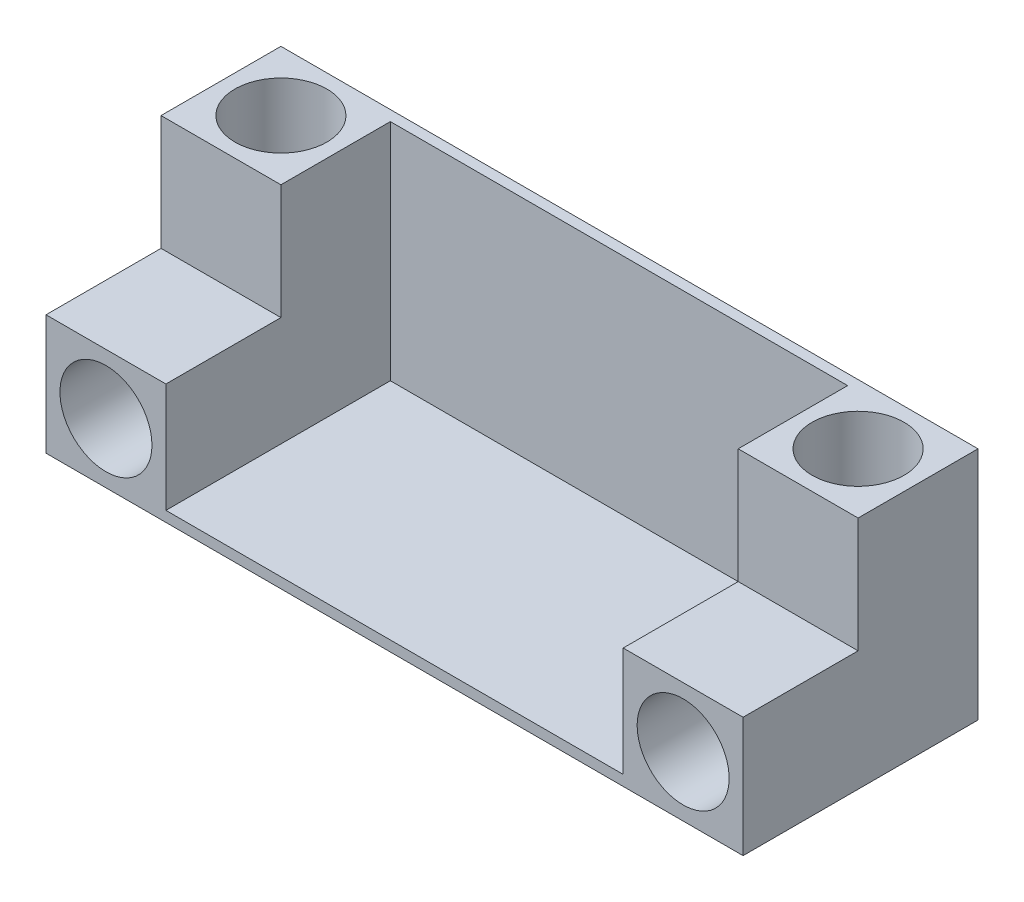
from build123d import *

# Parameters (mm, degrees)
SKETCH1_R           = 13.2
BOSS_EXTRUDE3_DEPTH = 5
SKETCH1_6_W         = 100
SKETCH1_6_H         = 55
SKETCH1_6_R         = 13.2
BOSS_EXTRUDE4_DEPTH = 55
SKETCH2_W           = 65.6
SKETCH2_H           = 52
CUT_EXTRUDE1_DEPTH  = 52
SKETCH3_R           = 13.2
CUT_EXTRUDE2_DEPTH  = 22.6
SKETCH4_W           = 20.6
SKETCH4_H           = 20.6
CUT_EXTRUDE4_DEPTH  = 39
SKETCH9_R           = 13.2
BOSS_EXTRUDE5_DEPTH = 12.4
BOSS_EXTRUDE7_START = 12.4
SKETCH10_R          = 13.2
BOSS_EXTRUDE7_DEPTH = 12.4
MIRROR1_START       = 30.398461356
MIRROR1_OUTLINE_R   = 13.2
MIRROR1_DEPTH       = 37.001538644
MIRROR1_2_OUTLINE_W = 100
MIRROR1_2_OUTLINE_H = 67.4
MIRROR1_2_OUTLINE_R = 13.2
MIRROR1_2_DEPTH     = 3
MIRROR1_3_OUTLINE_W = 34.4
MIRROR1_3_OUTLINE_H = 33
MIRROR1_3_DEPTH     = 4.001538644
MIRROR1_START_2     = 3
MIRROR1_4_OUTLINE_R = 13.2
MIRROR1_4_DEPTH     = 0.998461256
MIRROR1_START_3     = 3.998461256
MIRROR1_5_OUTLINE_R = 13.2
MIRROR1_5_DEPTH     = 26.4000001
MIRROR1_START_4     = 4.9
MIRROR1_6_OUTLINE_R = 13.2
MIRROR1_6_DEPTH     = 35


with BuildPart() as part:
    # Sketch1 → Boss-Extrude3 (new body)
    with BuildSketch(Plane(origin=(0, 0, 0), x_dir=(1, 0, 0), z_dir=(0, 1, 0))):
        with Locations(Location((-32.8, 10.3, 0), (0, 0, 270))):
            Circle(SKETCH1_R)
    boss_extrude3 = extrude(amount=BOSS_EXTRUDE3_DEPTH)

    # Sketch1<6> → Boss-Extrude4 (add)
    with BuildSketch(Plane(origin=(0, 0, 0), x_dir=(1, 0, 0), z_dir=(0, 1, 0))):
        Rectangle(SKETCH1_6_W, SKETCH1_6_H)
        with Locations(Location((-32.8, 10.3, 0), (0, 0, 270))):
            Circle(SKETCH1_6_R, mode=Mode.SUBTRACT)
    extrude(amount=BOSS_EXTRUDE4_DEPTH)

    # Sketch2 → Cut-Extrude1 (cut)
    with BuildSketch(Plane(origin=(0, 55, 0), x_dir=(1, 0, 0), z_dir=(0, 1, 0))):
        with Locations((17.2, -1.5)):
            Rectangle(SKETCH2_W, SKETCH2_H)
    extrude(amount=-CUT_EXTRUDE1_DEPTH, mode=Mode.SUBTRACT)

    # Sketch3 → Cut-Extrude2 (cut)
    with BuildSketch(Plane.XY.offset(27.5)):
        with Locations((-32.801538644, 17.198461356)):
            Circle(SKETCH3_R)
    extrude(amount=-CUT_EXTRUDE2_DEPTH, mode=Mode.SUBTRACT)

    # Sketch4 → Cut-Extrude4 (cut)
    with BuildSketch(Plane.ZY.offset(50)):
        with Locations((17.2, 44.7)):
            Rectangle(SKETCH4_W, SKETCH4_H)
    extrude(amount=-CUT_EXTRUDE4_DEPTH, mode=Mode.SUBTRACT)

    # Sketch9 → Boss-Extrude5 (add)
    with BuildSketch(Plane(origin=(0, 55, 0), x_dir=(1, 0, 0), z_dir=(0, 1, 0))):
        Polygon((-50, -6.9), (-15.6, -6.9), (-15.6, 24.5), (50, 24.5), (50, 27.5), (-50, 27.5), align=None)
        with Locations(Location((-32.8, 10.3, 0), (0, 0, 270))):
            Circle(SKETCH9_R, mode=Mode.SUBTRACT)
    extrude(amount=BOSS_EXTRUDE5_DEPTH)

    # Sketch10 → Boss-Extrude7 (add)
    with BuildSketch(Plane.XY.offset(27.5).offset(BOSS_EXTRUDE7_START)):
        Polygon((-15.6, 3), (-15.6, 34.4), (-50, 34.4), (-50, 0), (50, 0), (50, 3), align=None)
        with Locations((-32.801538644, 17.198461356)):
            Circle(SKETCH10_R, mode=Mode.SUBTRACT)
    extrude(amount=-BOSS_EXTRUDE7_DEPTH)

    # Mirror1: read off the stored shape, not the designer's step
    # Mirror1 outline → Mirror1 (add)
    with BuildSketch(Plane(origin=(0, 0, 0), x_dir=(1, 0, 0), z_dir=(0, 1, 0)).offset(MIRROR1_START)):
        Polygon((150, -6.9), (150, 27.5), (50, 27.5), (50, 24.5), (115.6, 24.5), (115.6, -6.9), align=None)
        with Locations((132.8, 10.3)):
            Circle(MIRROR1_OUTLINE_R, mode=Mode.SUBTRACT)
    extrude(amount=MIRROR1_DEPTH)

    # Mirror1 2 outline → Mirror1 2 (add)
    with BuildSketch(Plane(origin=(0, 0, 0), x_dir=(1, 0, 0), z_dir=(0, 1, 0))):
        with Locations((100, -6.2)):
            Rectangle(MIRROR1_2_OUTLINE_W, MIRROR1_2_OUTLINE_H)
        with Locations((132.8, 10.3)):
            Circle(MIRROR1_2_OUTLINE_R, mode=Mode.SUBTRACT)
    extrude(amount=MIRROR1_2_DEPTH)

    # Mirror1 3 outline → Mirror1 3 (add)
    with BuildSketch(Plane(origin=(0, 0, 0), x_dir=(1, 0, 0), z_dir=(0, 1, 0)).offset(MIRROR1_START)):
        with Locations((132.8, -23.4)):
            Rectangle(MIRROR1_3_OUTLINE_W, MIRROR1_3_OUTLINE_H)
    extrude(amount=MIRROR1_3_DEPTH)

    # Mirror1 4 outline → Mirror1 4 (add)
    with BuildSketch(Plane(origin=(0, 0, 0), x_dir=(1, 0, 0), z_dir=(0, 1, 0)).offset(MIRROR1_START_2)):
        Polygon((150, 27.5), (50, 27.5), (50, 24.5), (115.6, 24.5), (115.6, -39.9), (150, -39.9), align=None)
        with Locations((132.8, 10.3)):
            Circle(MIRROR1_4_OUTLINE_R, mode=Mode.SUBTRACT)
    extrude(amount=MIRROR1_4_DEPTH)

    # Mirror1 5 outline → Mirror1 5 (add)
    with BuildSketch(Plane(origin=(0, 0, 0), x_dir=(1, 0, 0), z_dir=(0, 1, 0)).offset(MIRROR1_START_3)):
        Polygon((150, -39.9), (150, 27.5), (50, 27.5), (50, 24.5), (115.6, 24.5), (115.6, -39.9), align=None)
        with Locations((132.8, 10.3)):
            Circle(MIRROR1_5_OUTLINE_R, mode=Mode.SUBTRACT)
    extrude(amount=MIRROR1_5_DEPTH)

    # Mirror1 6 outline → Mirror1 6 (cut)
    with BuildSketch(Plane.XY.offset(MIRROR1_START_4)):
        with Locations((132.801538644, 17.198461356)):
            Circle(MIRROR1_6_OUTLINE_R)
    extrude(amount=MIRROR1_6_DEPTH, mode=Mode.SUBTRACT)

    # Mirror2: Boss-Extrude3 across plane
    add(boss_extrude3.mirror(Plane.ZY.offset(-50)))


solid = part.part
